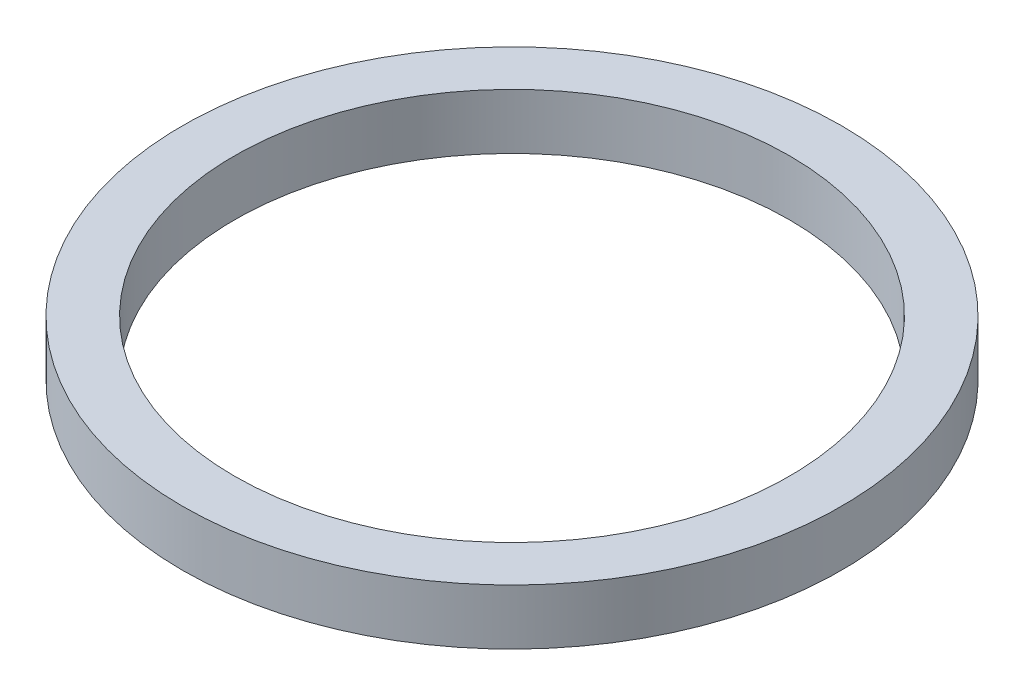
from build123d import *

# Parameters (mm, degrees)
SKETCH1_R           = 47.5
BOSS_EXTRUDE1_DEPTH = 8
SKETCH2_R           = 40
CUT_EXTRUDE1_DEPTH  = 68.649833703


with BuildPart() as part:
    # Sketch1 → Boss-Extrude1 (new body)
    with BuildSketch(Plane(origin=(0, 0, 0), x_dir=(1, 0, 0), z_dir=(0, 1, 0))):
        Circle(SKETCH1_R)
    extrude(amount=BOSS_EXTRUDE1_DEPTH)

    # Sketch2 → Cut-Extrude1 (cut, through all)
    with BuildSketch(Plane(origin=(0, 0, 0), x_dir=(1, 0, 0), z_dir=(0, 1, 0))):
        Circle(SKETCH2_R)
    extrude(amount=CUT_EXTRUDE1_DEPTH, mode=Mode.SUBTRACT)


solid = part.part
